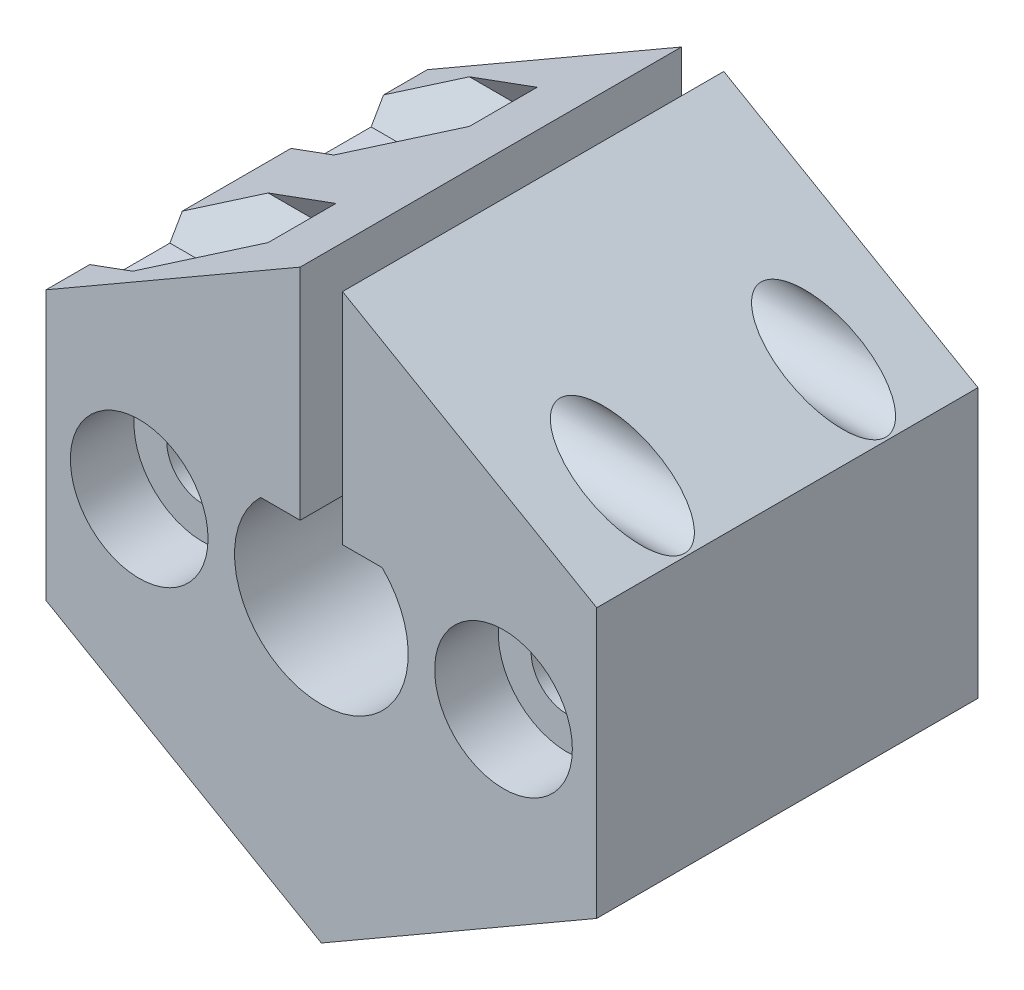
from build123d import *

# Parameters (mm, degrees)
BOSS_EXTRUDE1_DEPTH            = 18
SKETCH41_R                     = 1.7
CUT_EXTRUDE7_DEPTH             = 18
CBORE_FOR_M3_SHCS1_D           = 3.4
CBORE_FOR_M3_SHCS1_CBORE_D     = 6.5
CBORE_FOR_M3_SHCS1_CBORE_DEPTH = 3
CBORE_FOR_M3_SHCS2_D           = 3.4
CBORE_FOR_M3_SHCS2_CBORE_D     = 6.5
CBORE_FOR_M3_SHCS2_CBORE_DEPTH = 3
CUT_EXTRUDE9_DEPTH             = 4
CUT_EXTRUDE9_DEPTH_BACK        = 5
CUT_EXTRUDE10_DEPTH            = 24
CUT_EXTRUDE10_DEPTH_BACK       = 6
SKETCH51_R                     = 1.7


with BuildPart() as part:
    # Sketch1 → Boss-Extrude1 (new body)
    with BuildSketch(Plane(origin=(0, 0, 0), x_dir=(0, 1, 0), z_dir=(0, 0, 1))):
        with BuildLine():
            ThreePointArc((-4.1, 0), (-1.549654339, 3.795862409), (2.928571429, 2.86940227))
            Line((2.928571429, 2.86940227), (2.928571429, 1))
            Line((2.928571429, 1), (13.279056191, 1))
            Line((13.279056191, 1), (6.350852961, 13))
            Line((6.350852961, 13), (-6.350852961, 13))
            Line((-6.350852961, 13), (-13.856406461, 0))
            Line((-13.856406461, 0), (-6.350852961, -13))
            Line((-6.350852961, -13), (6.350852961, -13))
            Line((6.350852961, -13), (13.279056191, -1))
            Line((13.279056191, -1), (2.928571429, -1))
            Line((2.928571429, -1), (2.928571429, -2.86940227))
            ThreePointArc((2.928571429, -2.86940227), (-1.549654339, -3.795862409), (-4.1, 0))
        make_face()
    extrude(amount=BOSS_EXTRUDE1_DEPTH)

    # Sketch41 → Cut-Extrude7 (cut)
    with BuildSketch(Plane(origin=(0, 0, 0), x_dir=(0, 1, 0), z_dir=(0, 0, 1))):
        with Locations((0, 8.6)):
            Circle(SKETCH41_R)
        with Locations((0, -8.6)):
            Circle(SKETCH41_R)
    extrude(amount=CUT_EXTRUDE7_DEPTH, mode=Mode.SUBTRACT)

    # CBORE for M3 SHCS1 (through all)
    with Locations(Plane(origin=(-8.6, 0, 18), x_dir=(1, 0, 0), z_dir=(0, 0, 1))):
        with Locations((0, 0)):
            CounterBoreHole(CBORE_FOR_M3_SHCS1_D / 2, CBORE_FOR_M3_SHCS1_CBORE_D / 2, CBORE_FOR_M3_SHCS1_CBORE_DEPTH)

    # CBORE for M3 SHCS2 (through all)
    with Locations(Plane(origin=(8.6, 0, 18), x_dir=(1, 0, 0), z_dir=(0, 0, 1))):
        with Locations((0, 0)):
            CounterBoreHole(CBORE_FOR_M3_SHCS2_D / 2, CBORE_FOR_M3_SHCS2_CBORE_D / 2, CBORE_FOR_M3_SHCS2_CBORE_DEPTH)

    # Sketch50 → Cut-Extrude9 (cut, two sides: drawn at the far end of the back side and taken through both)
    with BuildSketch(Plane.YZ.offset(-8).offset(-CUT_EXTRUDE9_DEPTH_BACK)):
        Polygon((5.336406461, 5.849260246), (5.336406461, 2.650739754), (8.106406461, 1.051479509), (10.876406461, 2.650739754), (10.876406461, 5.849260246), (8.106406461, 7.448520491), align=None)
        Polygon((5.336406461, 15.349260246), (8.106406461, 16.948520491), (10.876406461, 15.349260246), (10.876406461, 12.150739754), (8.106406461, 10.551479509), (5.336406461, 12.150739754), align=None)
    extrude(amount=CUT_EXTRUDE9_DEPTH + CUT_EXTRUDE9_DEPTH_BACK, mode=Mode.SUBTRACT)

    # Sketch51 → Cut-Extrude10 (cut, two sides: drawn at the far end of the back side and taken through both)
    with BuildSketch(Plane.YZ.offset(-8).offset(-CUT_EXTRUDE10_DEPTH_BACK)):
        with Locations((8.106406461, 13.75)):
            Circle(SKETCH51_R)
        with Locations((8.106406461, 4.25)):
            Circle(SKETCH51_R)
    extrude(amount=CUT_EXTRUDE10_DEPTH + CUT_EXTRUDE10_DEPTH_BACK, mode=Mode.SUBTRACT)


solid = part.part
